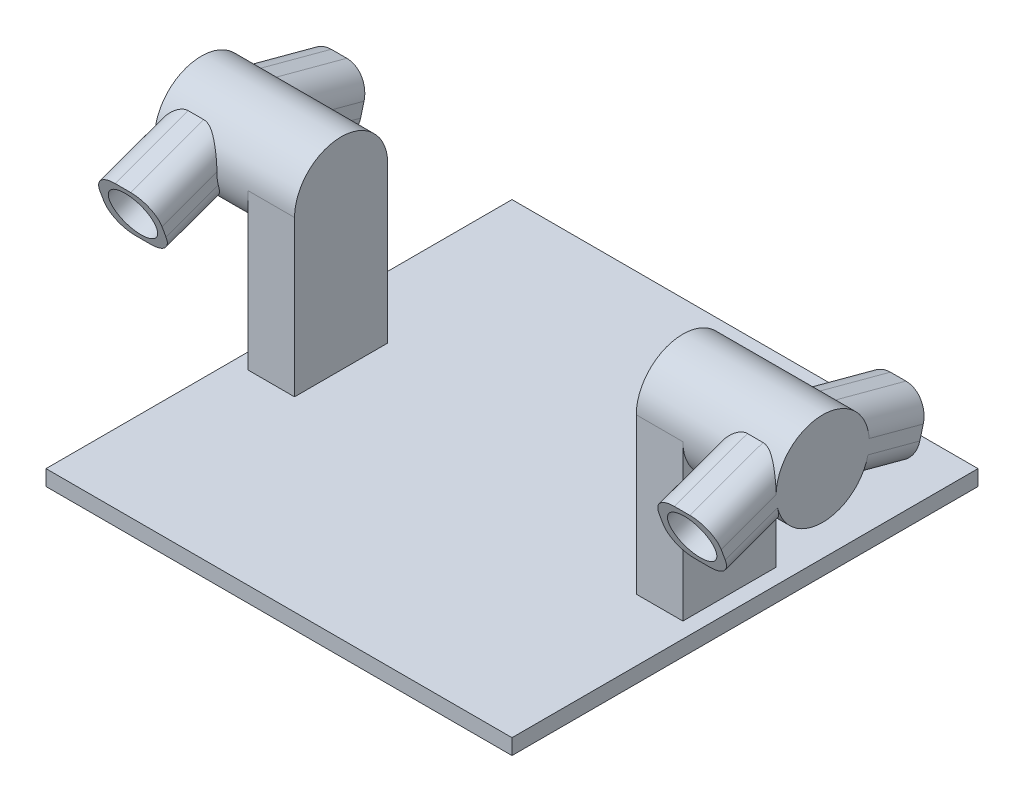
from build123d import *

# Parameters (mm, degrees)
SKETCH2_W           = 300
SKETCH2_H           = 300
BOSS_EXTRUDE1_DEPTH = 10
SKETCH3_W           = 30
SKETCH3_H           = 60
BOSS_EXTRUDE2_DEPTH = 130
FILLET1_R           = 30
SKETCH4_R           = 30
BOSS_EXTRUDE4_DEPTH = 60
BOSS_EXTRUDE5_START = 60
SKETCH5_R           = 30
BOSS_EXTRUDE5_DEPTH = 60
BOSS_EXTRUDE6_START = -40
BOSS_EXTRUDE6_DEPTH = 40
BOSS_EXTRUDE7_DEPTH = 40
SKETCH8_R           = 15.05
CUT_EXTRUDE1_DEPTH  = 40
SKETCH9_R           = 15.05
CUT_EXTRUDE2_DEPTH  = 40
FILLET2_R           = 15


with BuildPart() as part:
    # Sketch2 → Boss-Extrude1 (new body)
    with BuildSketch(Plane(origin=(0, 0, 0), x_dir=(1, 0, 0), z_dir=(0, 1, 0))):
        Rectangle(SKETCH2_W, SKETCH2_H)
    extrude(amount=BOSS_EXTRUDE1_DEPTH)

    # Sketch3 → Boss-Extrude2 (add)
    with BuildSketch(Plane(origin=(0, 10, 0), x_dir=(1, 0, 0), z_dir=(0, 1, 0))):
        with Locations((-125, 0)):
            Rectangle(SKETCH3_W, SKETCH3_H)
        with Locations((125, 0)):
            Rectangle(SKETCH3_W, SKETCH3_H)
    extrude(amount=BOSS_EXTRUDE2_DEPTH)

    # Fillet1
    fillet1_edges = [part.edges().sort_by_distance(p)[0] for p in [
        (125, 140, -30),
        (125, 140, 30),
        (-125, 140, 30),
        (-125, 140, -30),
    ]]
    fillet(fillet1_edges, radius=FILLET1_R - 0.0001)  # a hair under: the kernel refuses the full size

    # Sketch4 → Boss-Extrude4 (add)
    with BuildSketch(Plane.ZY.offset(140)):
        with Locations((0, 110)):
            Circle(SKETCH4_R)
    extrude(amount=BOSS_EXTRUDE4_DEPTH)

    # Sketch5 → Boss-Extrude5 (add)
    with BuildSketch(Plane(origin=(140, 0, 0), x_dir=(0, 0, -1), z_dir=(1, 0, 0)).offset(BOSS_EXTRUDE5_START)):
        with Locations((0, 110)):
            Circle(SKETCH5_R)
    extrude(amount=-BOSS_EXTRUDE5_DEPTH)

    # Sketch6 → Boss-Extrude6 (add)
    with BuildSketch(Plane.ZY.offset(200).offset(BOSS_EXTRUDE6_START)):
        with BuildLine():
            Line((-21.895741175, 89.492037683), (-58.637033052, 79.647238196))
            Line((-58.637033052, 79.647238196), (-68.637033052, 116.967746272))
            Line((-68.637033052, 116.967746272), (-23.070072037, 129.177376677))
            ThreePointArc((-23.070072037, 129.177376677), (-29.986874166, 109.112656899), (-21.895741175, 89.492037683))
        make_face()
        with BuildLine():
            Line((21.768001871, 89.356499945), (57.587704831, 76.319194267))
            Line((57.587704831, 76.319194267), (70.443457025, 111.640083129))
            Line((70.443457025, 111.640083129), (23.412322022, 128.758016354))
            ThreePointArc((23.412322022, 128.758016354), (29.973910166, 108.749116558), (21.768001871, 89.356499945))
        make_face()
    extrude(amount=BOSS_EXTRUDE6_DEPTH)

    # Sketch7 → Boss-Extrude7 (add)
    with BuildSketch(Plane(origin=(200, 0, 0), x_dir=(0, 0, -1), z_dir=(1, 0, 0))):
        with BuildLine():
            Line((-21.768001871, 89.356499945), (-57.587704831, 76.319194267))
            Line((-57.587704831, 76.319194267), (-70.443457025, 111.640083129))
            Line((-70.443457025, 111.640083129), (-23.412322022, 128.758016354))
            ThreePointArc((-23.412322022, 128.758016354), (-29.973910166, 108.749116558), (-21.768001871, 89.356499945))
        make_face()
        with BuildLine():
            Line((23.070072037, 129.177376677), (68.637033052, 116.967746272))
            Line((68.637033052, 116.967746272), (58.637033052, 79.647238196))
            Line((58.637033052, 79.647238196), (21.895741175, 89.492037683))
            ThreePointArc((21.895741175, 89.492037683), (29.986874166, 109.112656899), (23.070072037, 129.177376677))
        make_face()
    extrude(amount=-BOSS_EXTRUDE7_DEPTH)

    # Sketch8 → Cut-Extrude1 (cut)
    with BuildSketch(Plane(origin=(0, -9.323904974, -34.797287089), x_dir=(-1, 0, 0), z_dir=(0, -0.2588190451025219, -0.965925826289068))):
        with Locations(Location((-180, 111.428221794, 0), (0, 0, 90))):
            Circle(SKETCH8_R)
    cut_extrude1 = extrude(amount=-CUT_EXTRUDE1_DEPTH, mode=Mode.SUBTRACT)

    # Mirror1: Cut-Extrude1 across plane
    add(cut_extrude1.mirror(Plane(origin=(0, 0, 0), x_dir=(0, 0, 1), z_dir=(1, 0, 0))), mode=Mode.SUBTRACT)

    # Sketch9 → Cut-Extrude2 (cut)
    with BuildSketch(Plane(origin=(0, -9.58068177, 26.322706827), x_dir=(1, 0, 0), z_dir=(0, -0.3420201433256628, 0.9396926207859106))):
        with Locations(Location((180, 110.206591153, 0), (0, 0, 270))):
            Circle(SKETCH9_R)
    cut_extrude2 = extrude(amount=-CUT_EXTRUDE2_DEPTH, mode=Mode.SUBTRACT)

    # Mirror2: Cut-Extrude2 across plane
    add(cut_extrude2.mirror(Plane(origin=(0, 0, 0), x_dir=(0, 0, 1), z_dir=(1, 0, 0))), mode=Mode.SUBTRACT)

    # Fillet2
    fillet2_edges = [part.edges().sort_by_distance(p)[0] for p in [
        (160, 120.199049742, 46.927889523),
        (160, 82.837847106, 39.677853351),
        (200, 120.199049742, 46.927889523),
        (200, 82.837847106, 39.677853351),
        (160, 84.569637939, -40.266387113),
        (160, 123.072561474, -45.853552544),
        (200, 123.072561474, -45.853552544),
        (200, 84.569637939, -40.266387113),
        (-160, 123.072561474, -45.853552544),
        (-160, 84.569637939, -40.266387113),
        (-200, 84.569637939, -40.266387113),
        (-200, 123.072561474, -45.853552544),
        (-160, 82.837847106, 39.677853351),
        (-160, 120.199049742, 46.927889523),
        (-200, 120.199049742, 46.927889523),
        (-200, 82.837847106, 39.677853351),
    ]]
    fillet(fillet2_edges, radius=FILLET2_R)


solid = part.part
